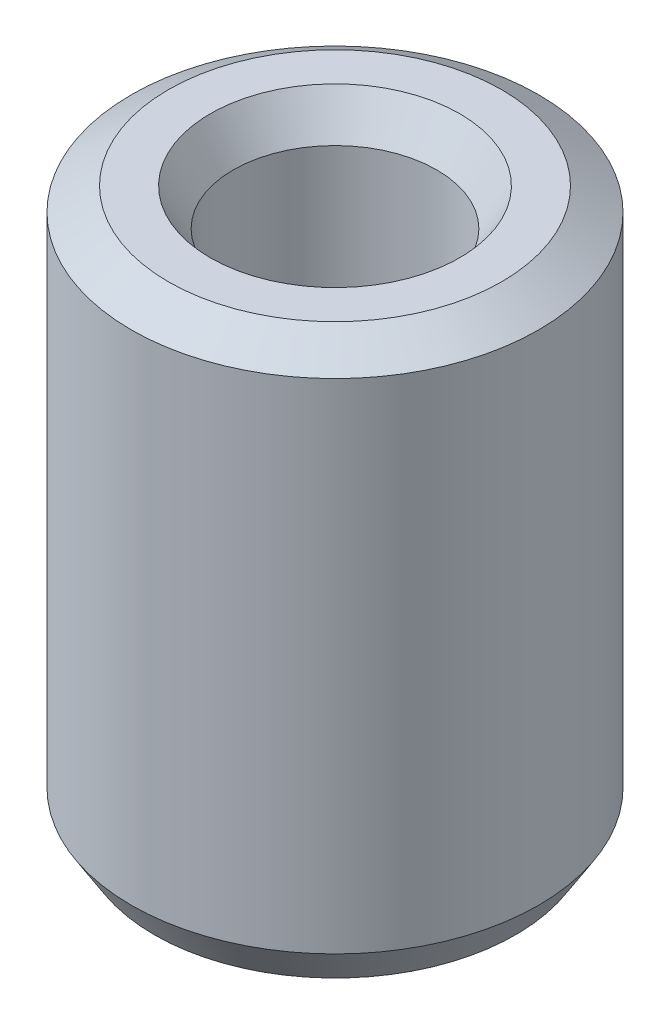
from build123d import *
from OCP.BRepFilletAPI import BRepFilletAPI_MakeChamfer

# Parameters (mm, degrees)
SKETCH1_R           = 7.5
BOSS_EXTRUDE1_DEPTH = 20.563598456
SKETCH2_R           = 3.747138215
CUT_EXTRUDE1_DEPTH  = 24.137881957
CHAMFER1_SIZE       = 0.847184465
CHAMFER1_SIZE2      = 1.367677462


with BuildPart() as part:
    # Sketch1 → Boss-Extrude1 (new body)
    with BuildSketch(Plane(origin=(0, 0, 0), x_dir=(1, 0, 0), z_dir=(0, 1, 0))):
        Circle(SKETCH1_R)
    extrude(amount=BOSS_EXTRUDE1_DEPTH)

    # Sketch2 → Cut-Extrude1 (cut, through all)
    with BuildSketch(Plane(origin=(0, 0, 0), x_dir=(1, 0, 0), z_dir=(0, 1, 0))):
        Circle(SKETCH2_R)
    extrude(amount=CUT_EXTRUDE1_DEPTH, mode=Mode.SUBTRACT)

    # Chamfer1: one chamfer whose edges measure the first distance from different faces: ONE call of the kernel's chamfer builder (chamfer() names one face for all edges)
    chamfer1_edges_1 = [part.edges().sort_by_distance(p)[0] for p in [
        (-3.747138215, 20.563598456, 0),
    ]]
    chamfer1_side_1 = [part.faces().sort_by_distance(p)[0] for p in [
        (-7.287867966, 20.563598456, 0),
    ]]
    chamfer1_edges_2 = [part.edges().sort_by_distance(p)[0] for p in [
        (-3.747138215, 0, 0),
    ]]
    chamfer1_side_2 = [part.faces().sort_by_distance(p)[0] for p in [
        (-3.747138215, 10.281799228, 0),
    ]]
    chamfer1_edges_3 = [part.edges().sort_by_distance(p)[0] for p in [
        (-7.5, 0, 0),
    ]]
    chamfer1_side_3 = [part.faces().sort_by_distance(p)[0] for p in [
        (-7.287867966, 0, 0),
    ]]
    chamfer1_edges_4 = [part.edges().sort_by_distance(p)[0] for p in [
        (-7.5, 20.563598456, 0),
    ]]
    chamfer1_side_4 = [part.faces().sort_by_distance(p)[0] for p in [
        (-7.5, 10.281799228, 0),
    ]]
    chamfer1 = BRepFilletAPI_MakeChamfer(part.part.solid().wrapped)
    for e in chamfer1_edges_1:
        chamfer1.Add(CHAMFER1_SIZE, CHAMFER1_SIZE2, e.wrapped, chamfer1_side_1[0].wrapped)  # the first distance lies on this face
    for e in chamfer1_edges_2:
        chamfer1.Add(CHAMFER1_SIZE, CHAMFER1_SIZE2, e.wrapped, chamfer1_side_2[0].wrapped)  # the first distance lies on this face
    for e in chamfer1_edges_3:
        chamfer1.Add(CHAMFER1_SIZE, CHAMFER1_SIZE2, e.wrapped, chamfer1_side_3[0].wrapped)  # the first distance lies on this face
    for e in chamfer1_edges_4:
        chamfer1.Add(CHAMFER1_SIZE, CHAMFER1_SIZE2, e.wrapped, chamfer1_side_4[0].wrapped)  # the first distance lies on this face
    add(Compound.cast(chamfer1.Shape()), mode=Mode.REPLACE)


solid = part.part
